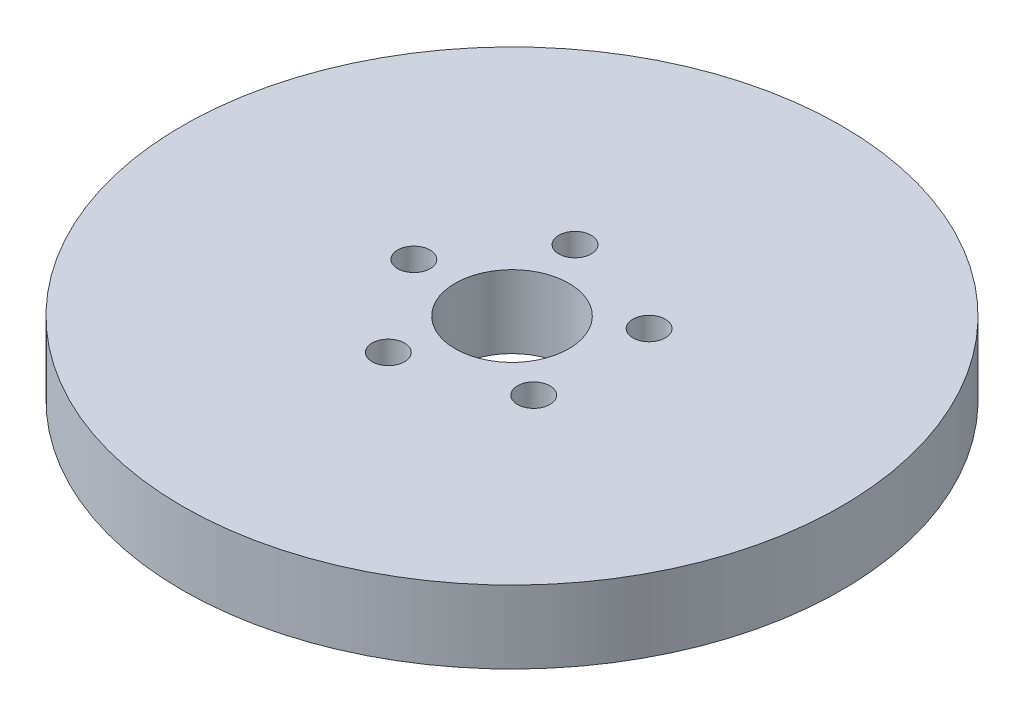
from build123d import *

# Parameters (mm, degrees)
SKETCH1_R           = 72.5
BOSS_EXTRUDE1_DEPTH = 16
SKETCH2_R           = 12.5
CUT_EXTRUDE1_DEPTH  = 104.771383339
SKETCH3_R           = 3.572044303
CUT_EXTRUDE2_DEPTH  = 13.928633482
CIRPATTERN1_COUNT   = 5


with BuildPart() as part:
    # Sketch1 → Boss-Extrude1 (new body)
    with BuildSketch(Plane(origin=(0, 0, 0), x_dir=(1, 0, 0), z_dir=(0, 1, 0))):
        Circle(SKETCH1_R)
    extrude(amount=BOSS_EXTRUDE1_DEPTH)

    # Sketch2 → Cut-Extrude1 (cut, through all)
    with BuildSketch(Plane(origin=(0, 0, 0), x_dir=(1, 0, 0), z_dir=(0, 1, 0))):
        Circle(SKETCH2_R)
    extrude(amount=CUT_EXTRUDE1_DEPTH, mode=Mode.SUBTRACT)

    # Sketch3 → Cut-Extrude2 (cut)
    with BuildSketch(Plane(origin=(0, 16, 0), x_dir=(1, 0, 0), z_dir=(0, 1, 0))):
        with Locations((-21.591481556, 0)):
            Circle(SKETCH3_R)
    cut_extrude2 = extrude(amount=-CUT_EXTRUDE2_DEPTH, mode=Mode.SUBTRACT)

    # CirPattern1: Cut-Extrude2 ×5 about axis
    cirpattern1_axis = Axis((0, 0, 0), (0, 1, 0))
    for i in range(1, CIRPATTERN1_COUNT):
        add(cut_extrude2.rotate(cirpattern1_axis, i * 360 / CIRPATTERN1_COUNT), mode=Mode.SUBTRACT)


solid = part.part
